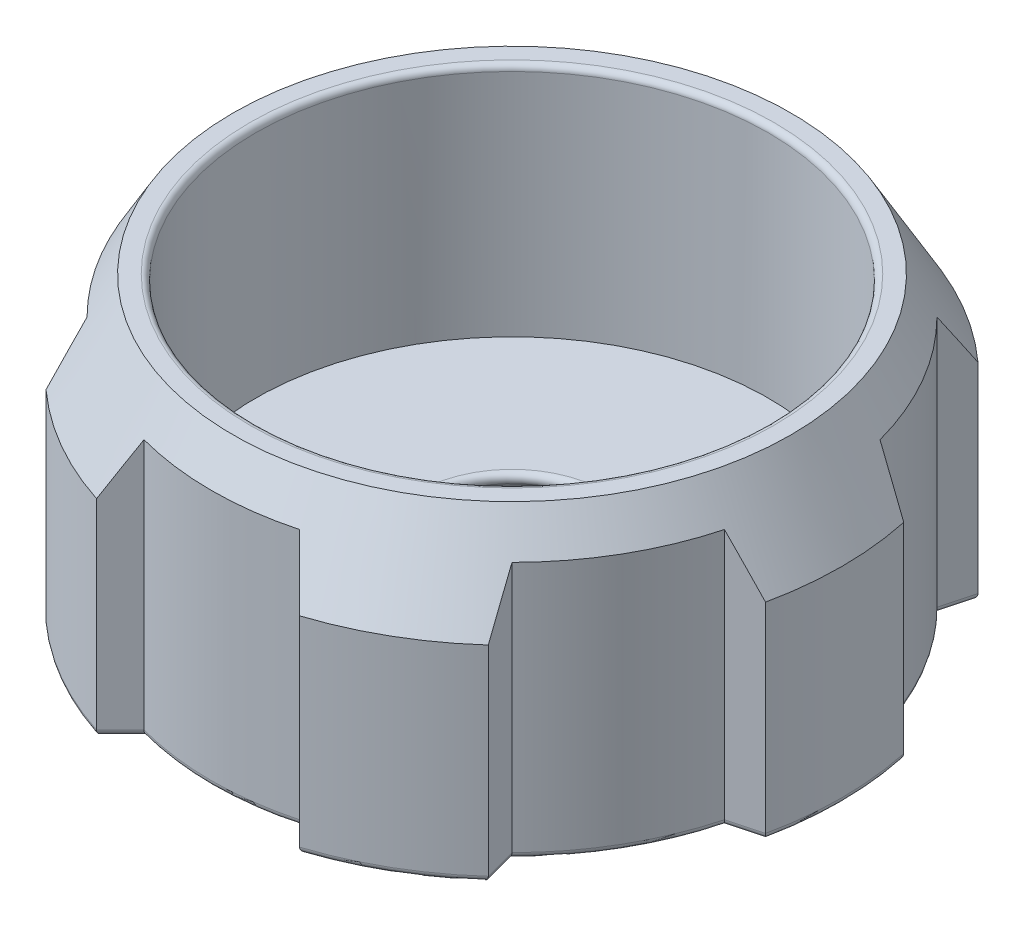
from build123d import *

# Parameters (mm, degrees)
SIDE_CUTOUT_DEPTH         = 94.658955792
SIDE_CUTOUT_PATTERN_COUNT = 6
OVERALL_FILLETS_R         = 1
SCREW_HOLE_PATTERN_COUNT  = 6


with BuildPart() as part:
    # Sketch1 → body (revolve)
    with BuildSketch(Plane.XY):
        Polygon((20, 0), (14.226497308, 10), (43.5, 10), (43.5, 50), (47.339745962, 50), (56, 35), (56, 0), align=None)
    revolve(axis=Axis((0, 0, 0), (0, 1, 0)))

    # Sketch5 → side_cutout (cut, symmetric)
    with BuildSketch(Plane.XZ):
        with BuildLine():
            Line((110.083964015, 312.314512522), (37.535126405, 41.55856453))
            Line((37.535126405, 41.55856453), (36.062445841, 36.062445841))
            ThreePointArc((36.062445841, 36.062445841), (44.167295593, 25.5), (49.262217141, 13.1997713))
            Line((49.262217141, 13.1997713), (54.75833583, 11.727090736))
            Line((54.75833583, 11.727090736), (325.514283822, -60.821746875))
            Line((325.514283822, -60.821746875), (811.02056765, 219.485436786))
            Line((811.02056765, 219.485436786), (595.590247843, 592.621696183))
            Line((595.590247843, 592.621696183), (110.083964015, 312.314512522))
        make_face()
    side_cutout = extrude(amount=SIDE_CUTOUT_DEPTH, both=True, mode=Mode.SUBTRACT)

    # side_cutout_pattern: side_cutout ×6 about axis
    side_cutout_pattern_axis = Axis((0, 0, 0), (0, -1, 0))
    for i in range(1, SIDE_CUTOUT_PATTERN_COUNT):
        add(side_cutout.rotate(side_cutout_pattern_axis, i * 360 / SIDE_CUTOUT_PATTERN_COUNT), mode=Mode.SUBTRACT)

    # overall_fillets
    overall_fillets_edges = [part.edges().sort_by_distance(p)[0] for p in [
        (-14.226497308, 10, 0),
        (-20, 0, 0),
        (-43.5, 50, 0),
        (28, 0, -48.497422612),
        (15.211490363, 0, -51.273936203),
        (0, 0, -51),
        (-15.211490363, 0, -51.273936203),
        (-28, 0, -48.497422612),
        (-36.798786123, 0, -38.810505185),
        (-44.167295593, 0, -25.5),
        (-52.010276485, 0, -12.463431018),
        (-56, 0, 0),
        (-52.010276485, 0, 12.463431018),
        (-44.167295593, 0, 25.5),
        (-36.798786123, 0, 38.810505185),
        (-28, 0, 48.497422612),
        (-15.211490363, 0, 51.273936203),
        (0, 0, 51),
        (15.211490363, 0, 51.273936203),
        (28, 0, 48.497422612),
        (36.798786123, 0, 38.810505185),
        (44.167295593, 0, 25.5),
        (52.010276485, 0, 12.463431018),
        (56, 0, 0),
        (52.010276485, 0, -12.463431018),
        (44.167295593, 0, -25.5),
        (36.798786123, 0, -38.810505185),
    ]]
    fillet(overall_fillets_edges, radius=OVERALL_FILLETS_R)

    # Sketch4 → screw_holes (revolve, cut)
    with BuildSketch(Plane(origin=(46, 0, 0), x_dir=(0, 0, -1), z_dir=(1, 0, 0))):
        Polygon((0, 0), (0, 8.811161836), (1.35, 8), (1.35, 0.3), (1.65, 0), align=None)
    screw_holes = revolve(axis=Axis((46, -6.35, 0), (0, 1, 0)), mode=Mode.SUBTRACT)

    # screw_hole_pattern: screw_holes ×6 about axis
    screw_hole_pattern_axis = Axis((0, 8.5, 0), (0, 1, 0))
    for i in range(1, SCREW_HOLE_PATTERN_COUNT):
        add(screw_holes.rotate(screw_hole_pattern_axis, i * 360 / SCREW_HOLE_PATTERN_COUNT), mode=Mode.SUBTRACT)


solid = part.part
